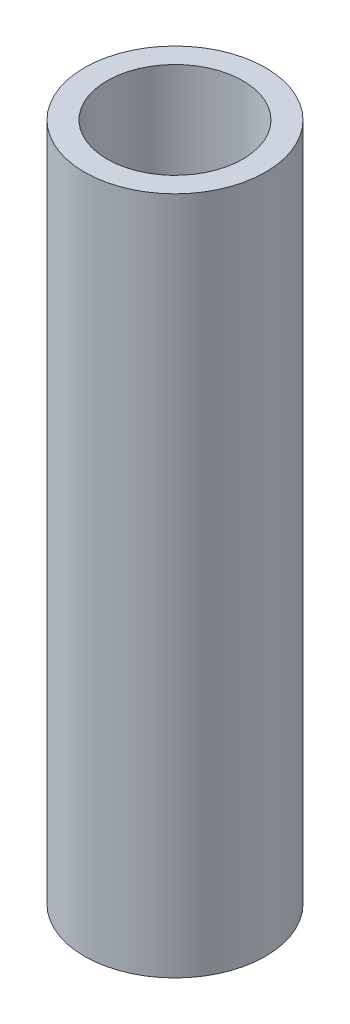
from build123d import *

# Parameters (mm, degrees)
SKETCH_1_R      = 8
SKETCH_1_R_2    = 6
EXTRUDE_1_DEPTH = 60


with BuildPart() as part:
    # 草图1 → 拉伸-薄壁1 (new body)
    with BuildSketch(Plane(origin=(0, 0, 0), x_dir=(1, 0, 0), z_dir=(0, 1, 0))):
        Circle(SKETCH_1_R)
        Circle(SKETCH_1_R_2, mode=Mode.SUBTRACT)
    extrude(amount=-EXTRUDE_1_DEPTH)


solid = part.part
